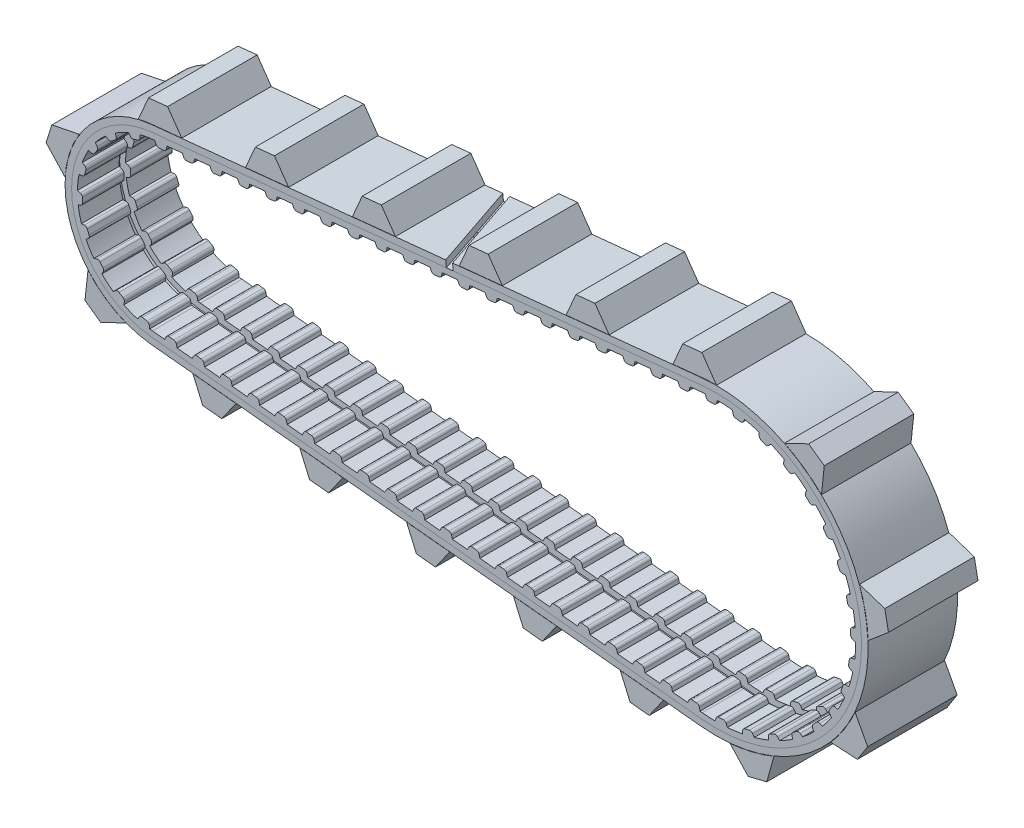
from build123d import *
from build123d.topology import SkipClean

# Parameters (mm, degrees)
EXTRUDE_3_DEPTH       = 20.55
EXTRUDE_1_DEPTH       = 20.55
PATTERN_START         = -20.55
PATTERN_CURVE_2_DEPTH = 41.1
CUT_EXTRUDE_2_DEPTH   = 1.5
EXTRUDE_4_DEPTH       = 20.55
EXTRUDE_2_DEPTH       = 20.55
PATTERN_CURVE_3_DEPTH = 41.1
CUT_EXTRUDE_3_DEPTH   = 321.456949745
CUT_EXTRUDE_START     = -3
CUT_EXTRUDE_1_DEPTH   = 3


# Read off the part's stored shape, not the designer's step: ｶｰﾌﾞ ﾊﾟﾀｰﾝ2, ｶｰﾌﾞ ﾊﾟﾀｰﾝ3, ｶｯﾄ - 押し出し1
with BuildPart() as part:
    # ｽｹｯﾁ1 → 押し出し-薄板3 (new, symmetric)
    with BuildSketch(Plane.XY):
        with BuildLine():
            Line((-259.132698255, 40.767459225), (-6.726519747, 66.354498334))
            ThreePointArc((-6.726519747, 66.354498334), (66.694568873, 0), (-6.726519747, -66.354498334))
            Line((-6.726519747, -66.354498334), (-259.132698255, -40.767459225))
            ThreePointArc((-259.132698255, -40.767459225), (-295.976394748, 0), (-259.132698255, 40.767459225))
        make_face()
        with BuildLine():
            Line((-258.860388176, 38.08122632), (-6.454209668, 63.668265429))
            ThreePointArc((-6.454209668, 63.668265429), (63.994568873, 0), (-6.454209668, -63.668265429))
            Line((-6.454209668, -63.668265429), (-258.860388176, -38.08122632))
            ThreePointArc((-258.860388176, -38.08122632), (-293.276394748, 0), (-258.860388176, 38.08122632))
        make_face(mode=Mode.SUBTRACT)
    extrude(amount=EXTRUDE_3_DEPTH, both=True)

    # ｽｹｯﾁ2 → ﾎﾞｽ - 押し出し1 (add, symmetric)
    with BuildSketch(Plane.XY):
        with BuildLine():
            Line((-18.031105741, 63.184202606), (-11.856400618, 63.810147749))
            Line((-11.856400618, 63.810147749), (-12.398399644, 61.670004094))
            ThreePointArc((-12.398399644, 61.670004094), (-12.831494961, 60.969079346), (-13.588299795, 60.643328675))
            Line((-13.588299795, 60.643328675), (-15.698914123, 60.429370476))
            ThreePointArc((-15.698914123, 60.429370476), (-16.505695259, 60.596616567), (-17.070643258, 61.196367193))
            Line((-17.070643258, 61.196367193), (-18.031105741, 63.184202606))
        make_face()
    extrude(amount=EXTRUDE_1_DEPTH, both=True)

    # ｶｰﾌﾞ ﾊﾟﾀｰﾝ2 outline → ｶｰﾌﾞ ﾊﾟﾀｰﾝ2 (add)
    with BuildSketch(Plane.XY.offset(PATTERN_START)):
        with BuildLine():
            Line((0.122769317, 62.649899214), (0.557965581, 63.992136389))
            ThreePointArc((0.557965581, 63.992136389), (-2.27316707, 63.954183262), (-5.09984989, 63.791036802))
            Line((-5.09984989, 63.791036802), (-4.570456144, 62.483084707))
            ThreePointArc((-4.570456144, 62.483084707), (-4.045974307, 61.847643239), (-3.251869686, 61.627950485))
            Line((-3.251869686, 61.627950485), (-1.131777131, 61.703306378))
            ThreePointArc((-1.131777131, 61.703306378), (-0.35527412, 61.978824308), (0.122769317, 62.649899214))
        make_face()
        with BuildLine():
            Line((12.342799351, 61.422147863), (13.031490923, 62.653691747))
            ThreePointArc((13.031490923, 62.653691747), (10.247353404, 63.168794459), (7.443156207, 63.560241274))
            Line((7.443156207, 63.560241274), (7.707209005, 62.174141516))
            ThreePointArc((7.707209005, 62.174141516), (8.09764459, 61.448588547), (8.833630784, 61.078195002))
            Line((8.833630784, 61.078195002), (10.92768756, 60.738493413))
            ThreePointArc((10.92768756, 60.738493413), (11.743021166, 60.857229121), (12.342799351, 61.422147863))
        make_face()
        with BuildLine():
            Line((24.088502528, 57.833977814), (25.004223378, 58.907500868))
            ThreePointArc((25.004223378, 58.907500868), (22.374073835, 59.955864311), (19.700125986, 60.886861319))
            Line((19.700125986, 60.886861319), (19.688690434, 59.475880934))
            ThreePointArc((19.688690434, 59.475880934), (19.930075547, 58.688099058), (20.579659776, 58.181238737))
            Line((20.579659776, 58.181238737), (22.567207347, 57.439534208))
            ThreePointArc((22.567207347, 57.439534208), (23.390038733, 57.396924747), (24.088502528, 57.833977814))
        make_face()
        with BuildLine():
            Line((34.908498061, 52.023280433), (36.01605755, 52.897527766))
            ThreePointArc((36.01605755, 52.897527766), (33.640971154, 54.438863921), (31.20003097, 55.87363343))
            Line((31.20003097, 55.87363343), (30.913546532, 54.491995602))
            ThreePointArc((30.913546532, 54.491995602), (30.996604878, 53.672258835), (31.534823985, 53.048410096))
            Line((31.534823985, 53.048410096), (33.339482011, 51.933205916))
            ThreePointArc((33.339482011, 51.933205916), (34.138190229, 51.730888744), (34.908498061, 52.023280433))
        make_face()
        with BuildLine():
            Line((44.386979592, 44.213357559), (45.643814829, 44.854732337))
            ThreePointArc((45.643814829, 44.854732337), (43.61506482, 46.82980852), (41.500936262, 48.713213142))
            Line((41.500936262, 48.713213142), (40.950412373, 47.414013439))
            ThreePointArc((40.950412373, 47.414013439), (40.871952066, 46.593823804), (41.278122593, 45.876960805))
            Line((41.278122593, 45.876960805), (42.830539078, 44.431113646))
            ThreePointArc((42.830539078, 44.431113646), (43.57443022, 44.076863698), (44.386979592, 44.213357559))
        make_face()
        with BuildLine():
            Line((52.159694389, 34.704340149), (53.517505901, 35.0881947))
            ThreePointArc((53.517505901, 35.0881947), (51.913056003, 37.42110984), (50.206983847, 39.680771391))
            Line((50.206983847, 39.680771391), (49.413576832, 38.513937329))
            ThreePointArc((49.413576832, 38.513937329), (49.176613058, 37.724814255), (49.435126098, 36.942485638))
            Line((49.435126098, 36.942485638), (50.675642548, 35.221558595))
            ThreePointArc((50.675642548, 35.221558595), (51.336129294, 34.728989498), (52.159694389, 34.704340149))
        make_face()
        with BuildLine():
            Line((57.927941382, 23.86165441), (59.334549235, 23.973237418))
            ThreePointArc((59.334549235, 23.973237418), (58.216057557, 26.574338895), (56.983605199, 29.123419849))
            Line((56.983605199, 29.123419849), (55.977805244, 28.133792206))
            ThreePointArc((55.977805244, 28.133792206), (55.591444388, 27.40606125), (55.692365431, 26.588331466))
            Line((55.692365431, 26.588331466), (56.573309494, 24.658458799))
            ThreePointArc((56.573309494, 24.658458799), (57.125009709, 24.046499708), (57.927941382, 23.86165441))
        make_face()
        with BuildLine():
            Line((61.470050074, 12.101978673), (62.871399117, 11.937002066))
            ThreePointArc((62.871399117, 11.937002066), (62.281848668, 14.706331009), (61.570378561, 17.446871615))
            Line((61.570378561, 17.446871615), (60.390837994, 16.672481227))
            ThreePointArc((60.390837994, 16.672481227), (59.869927686, 16.034108681), (59.809378393, 15.212402627))
            Line((59.809378393, 15.212402627), (60.296895883, 13.147748261))
            ThreePointArc((60.296895883, 13.147748261), (60.718608036, 12.439916419), (61.470050074, 12.101978673))
        make_face()
        with BuildLine():
            Line((62.649899214, -0.122769317), (63.992136389, -0.557965581))
            ThreePointArc((63.992136389, -0.557965581), (63.954183262, 2.27316707), (63.791036803, 5.09984989))
            Line((63.791036803, 5.09984989), (62.483084707, 4.570456144))
            ThreePointArc((62.483084707, 4.570456144), (61.847643239, 4.045974307), (61.627950485, 3.251869686))
            Line((61.627950485, 3.251869686), (61.703306378, 1.131777131))
            ThreePointArc((61.703306378, 1.131777131), (61.978824308, 0.35527412), (62.649899214, -0.122769317))
        make_face()
        with BuildLine():
            Line((61.422147863, -12.342799351), (62.653691747, -13.031490923))
            ThreePointArc((62.653691747, -13.031490923), (63.168794459, -10.247353404), (63.560241275, -7.443156207))
            Line((63.560241275, -7.443156207), (62.174141516, -7.707209005))
            ThreePointArc((62.174141516, -7.707209005), (61.448588547, -8.09764459), (61.078195002, -8.833630784))
            Line((61.078195002, -8.833630784), (60.738493413, -10.92768756))
            ThreePointArc((60.738493413, -10.92768756), (60.857229121, -11.743021166), (61.422147863, -12.342799351))
        make_face()
        with BuildLine():
            Line((57.833977814, -24.088502528), (58.907500868, -25.004223378))
            ThreePointArc((58.907500868, -25.004223378), (59.955864311, -22.374073835), (60.88686132, -19.700125986))
            Line((60.88686132, -19.700125986), (59.475880934, -19.688690434))
            ThreePointArc((59.475880934, -19.688690434), (58.688099058, -19.930075547), (58.181238737, -20.579659776))
            Line((58.181238737, -20.579659776), (57.439534208, -22.567207347))
            ThreePointArc((57.439534208, -22.567207347), (57.396924747, -23.390038733), (57.833977814, -24.088502528))
        make_face()
        with BuildLine():
            Line((52.023280433, -34.908498061), (52.897527766, -36.01605755))
            ThreePointArc((52.897527766, -36.01605755), (54.438863921, -33.640971155), (55.87363343, -31.20003097))
            Line((55.87363343, -31.20003097), (54.491995602, -30.913546532))
            ThreePointArc((54.491995602, -30.913546532), (53.672258835, -30.996604878), (53.048410096, -31.534823985))
            Line((53.048410096, -31.534823985), (51.933205916, -33.339482011))
            ThreePointArc((51.933205916, -33.339482011), (51.730888744, -34.138190229), (52.023280433, -34.908498061))
        make_face()
        with BuildLine():
            Line((44.213357559, -44.386979592), (44.854732337, -45.643814829))
            ThreePointArc((44.854732337, -45.643814829), (46.82980852, -43.61506482), (48.713213142, -41.500936262))
            Line((48.713213142, -41.500936262), (47.414013439, -40.950412373))
            ThreePointArc((47.414013439, -40.950412373), (46.593823804, -40.871952066), (45.876960805, -41.278122593))
            Line((45.876960805, -41.278122593), (44.431113646, -42.830539078))
            ThreePointArc((44.431113646, -42.830539078), (44.076863698, -43.57443022), (44.213357559, -44.386979592))
        make_face()
        with BuildLine():
            Line((34.704340149, -52.159694389), (35.0881947, -53.517505901))
            ThreePointArc((35.0881947, -53.517505901), (37.42110984, -51.913056003), (39.680771391, -50.206983847))
            Line((39.680771391, -50.206983847), (38.513937329, -49.413576832))
            ThreePointArc((38.513937329, -49.413576832), (37.724814255, -49.176613058), (36.942485638, -49.435126098))
            Line((36.942485638, -49.435126098), (35.221558595, -50.675642548))
            ThreePointArc((35.221558595, -50.675642548), (34.728989498, -51.336129294), (34.704340149, -52.159694389))
        make_face()
        with BuildLine():
            Line((23.86165441, -57.927941382), (23.973237418, -59.334549235))
            ThreePointArc((23.973237418, -59.334549235), (26.574338895, -58.216057557), (29.123419849, -56.983605199))
            Line((29.123419849, -56.983605199), (28.133792206, -55.977805244))
            ThreePointArc((28.133792206, -55.977805244), (27.40606125, -55.591444388), (26.588331466, -55.692365431))
            Line((26.588331466, -55.692365431), (24.658458799, -56.573309494))
            ThreePointArc((24.658458799, -56.573309494), (24.046499708, -57.125009709), (23.86165441, -57.927941382))
        make_face()
        with BuildLine():
            Line((12.101978673, -61.470050074), (11.937002066, -62.871399117))
            ThreePointArc((11.937002066, -62.871399117), (14.706331009, -62.281848668), (17.446871615, -61.57037856))
            Line((17.446871615, -61.57037856), (16.672481227, -60.390837994))
            ThreePointArc((16.672481227, -60.390837994), (16.034108681, -59.869927686), (15.212402627, -59.809378393))
            Line((15.212402627, -59.809378393), (13.147748261, -60.296895883))
            ThreePointArc((13.147748261, -60.296895883), (12.439916419, -60.718608036), (12.101978673, -61.470050074))
        make_face()
        with BuildLine():
            Line((-0.122769317, -62.649899214), (-0.557965581, -63.992136389))
            ThreePointArc((-0.557965581, -63.992136389), (2.27316707, -63.954183262), (5.09984989, -63.791036802))
            Line((5.09984989, -63.791036802), (4.570456144, -62.483084707))
            ThreePointArc((4.570456144, -62.483084707), (4.045974307, -61.847643239), (3.251869686, -61.627950485))
            Line((3.251869686, -61.627950485), (1.131777131, -61.703306378))
            ThreePointArc((1.131777131, -61.703306378), (0.35527412, -61.978824308), (-0.122769317, -62.649899214))
        make_face()
        with BuildLine():
            Line((-12.498041941, -61.659903107), (-13.140907029, -62.990418366))
            Line((-13.140907029, -62.990418366), (-7.463022832, -63.565999541))
            Line((-7.463022832, -63.565999541), (-7.825798326, -62.133540008))
            ThreePointArc((-7.825798326, -62.133540008), (-8.258893644, -61.43261526), (-9.015698478, -61.106864589))
            Line((-9.015698478, -61.106864589), (-11.126312806, -60.89290639))
            ThreePointArc((-11.126312806, -60.89290639), (-11.933093941, -61.060152481), (-12.498041941, -61.659903107))
        make_face()
        with BuildLine():
            Line((-25.133285606, -60.37903718), (-25.776150694, -61.709552439))
            Line((-25.776150694, -61.709552439), (-20.098266497, -62.285133614))
            Line((-20.098266497, -62.285133614), (-20.461041992, -60.852674081))
            ThreePointArc((-20.461041992, -60.852674081), (-20.894137309, -60.151749333), (-21.650942143, -59.825998662))
            Line((-21.650942143, -59.825998662), (-23.761556471, -59.612040463))
            ThreePointArc((-23.761556471, -59.612040463), (-24.568337607, -59.779286554), (-25.133285606, -60.37903718))
        make_face()
        with BuildLine():
            Line((-37.768529271, -59.098171253), (-38.411394359, -60.428686512))
            Line((-38.411394359, -60.428686512), (-32.733510163, -61.004267687))
            Line((-32.733510163, -61.004267687), (-33.096285657, -59.571808154))
            ThreePointArc((-33.096285657, -59.571808154), (-33.529380974, -58.870883406), (-34.286185808, -58.545132735))
            Line((-34.286185808, -58.545132735), (-36.396800136, -58.331174536))
            ThreePointArc((-36.396800136, -58.331174536), (-37.203581272, -58.498420627), (-37.768529271, -59.098171253))
        make_face()
        with BuildLine():
            Line((-50.403772937, -57.817305326), (-51.046638025, -59.147820585))
            Line((-51.046638025, -59.147820585), (-45.368753828, -59.72340176))
            Line((-45.368753828, -59.72340176), (-45.731529322, -58.290942227))
            ThreePointArc((-45.731529322, -58.290942227), (-46.164624639, -57.590017479), (-46.921429473, -57.264266808))
            Line((-46.921429473, -57.264266808), (-49.032043801, -57.050308609))
            ThreePointArc((-49.032043801, -57.050308609), (-49.838824937, -57.2175547), (-50.403772937, -57.817305326))
        make_face()
        with BuildLine():
            Line((-63.039016602, -56.536439399), (-63.68188169, -57.866954658))
            Line((-63.68188169, -57.866954658), (-58.003997493, -58.442535833))
            Line((-58.003997493, -58.442535833), (-58.366772987, -57.0100763))
            ThreePointArc((-58.366772987, -57.0100763), (-58.799868304, -56.309151552), (-59.556673138, -55.983400881))
            Line((-59.556673138, -55.983400881), (-61.667287466, -55.769442682))
            ThreePointArc((-61.667287466, -55.769442682), (-62.474068602, -55.936688773), (-63.039016602, -56.536439399))
        make_face()
        with BuildLine():
            Line((-75.674260267, -55.255573472), (-76.317125355, -56.586088731))
            Line((-76.317125355, -56.586088731), (-70.639241158, -57.161669906))
            Line((-70.639241158, -57.161669906), (-71.002016652, -55.729210373))
            ThreePointArc((-71.002016652, -55.729210373), (-71.435111969, -55.028285625), (-72.191916803, -54.702534954))
            Line((-72.191916803, -54.702534954), (-74.302531131, -54.488576755))
            ThreePointArc((-74.302531131, -54.488576755), (-75.109312267, -54.655822846), (-75.674260267, -55.255573472))
        make_face()
        with BuildLine():
            Line((-88.309503932, -53.974707545), (-88.95236902, -55.305222804))
            Line((-88.95236902, -55.305222804), (-83.274484823, -55.880803979))
            Line((-83.274484823, -55.880803979), (-83.637260317, -54.448344446))
            ThreePointArc((-83.637260317, -54.448344446), (-84.070355635, -53.747419698), (-84.827160468, -53.421669027))
            Line((-84.827160468, -53.421669027), (-86.937774796, -53.207710828))
            ThreePointArc((-86.937774796, -53.207710828), (-87.744555932, -53.374956919), (-88.309503932, -53.974707545))
        make_face()
        with BuildLine():
            Line((-100.944747597, -52.693841618), (-101.587612685, -54.024356877))
            Line((-101.587612685, -54.024356877), (-95.909728488, -54.599938052))
            Line((-95.909728488, -54.599938052), (-96.272503982, -53.167478519))
            ThreePointArc((-96.272503982, -53.167478519), (-96.7055993, -52.466553771), (-97.462404133, -52.1408031))
            Line((-97.462404133, -52.1408031), (-99.573018462, -51.926844901))
            ThreePointArc((-99.573018462, -51.926844901), (-100.379799597, -52.094090992), (-100.944747597, -52.693841618))
        make_face()
        with BuildLine():
            Line((-113.579991262, -51.412975691), (-114.22285635, -52.74349095))
            Line((-114.22285635, -52.74349095), (-108.544972153, -53.319072126))
            Line((-108.544972153, -53.319072126), (-108.907747647, -51.886612592))
            ThreePointArc((-108.907747647, -51.886612592), (-109.340842965, -51.185687844), (-110.097647799, -50.859937173))
            Line((-110.097647799, -50.859937173), (-112.208262127, -50.645978974))
            ThreePointArc((-112.208262127, -50.645978974), (-113.015043262, -50.813225065), (-113.579991262, -51.412975691))
        make_face()
        with BuildLine():
            Line((-126.215234927, -50.132109764), (-126.858100015, -51.462625023))
            Line((-126.858100015, -51.462625023), (-121.180215818, -52.038206199))
            Line((-121.180215818, -52.038206199), (-121.542991313, -50.605746665))
            ThreePointArc((-121.542991313, -50.605746665), (-121.97608663, -49.904821917), (-122.732891464, -49.579071246))
            Line((-122.732891464, -49.579071246), (-124.843505792, -49.365113047))
            ThreePointArc((-124.843505792, -49.365113047), (-125.650286928, -49.532359138), (-126.215234927, -50.132109764))
        make_face()
        with BuildLine():
            Line((-138.850478592, -48.851243837), (-139.49334368, -50.181759096))
            Line((-139.49334368, -50.181759096), (-133.815459484, -50.757340271))
            Line((-133.815459484, -50.757340271), (-134.178234978, -49.324880738))
            ThreePointArc((-134.178234978, -49.324880738), (-134.611330295, -48.62395599), (-135.368135129, -48.298205319))
            Line((-135.368135129, -48.298205319), (-137.478749457, -48.08424712))
            ThreePointArc((-137.478749457, -48.08424712), (-138.285530593, -48.251493211), (-138.850478592, -48.851243837))
        make_face()
        with BuildLine():
            Line((-151.485722258, -47.57037791), (-152.128587346, -48.900893169))
            Line((-152.128587346, -48.900893169), (-146.450703149, -49.476474345))
            Line((-146.450703149, -49.476474345), (-146.813478643, -48.044014811))
            ThreePointArc((-146.813478643, -48.044014811), (-147.24657396, -47.343090063), (-148.003378794, -47.017339392))
            Line((-148.003378794, -47.017339392), (-150.113993122, -46.803381193))
            ThreePointArc((-150.113993122, -46.803381193), (-150.920774258, -46.970627284), (-151.485722258, -47.57037791))
        make_face()
        with BuildLine():
            Line((-164.120965923, -46.289511983), (-164.763831011, -47.620027242))
            Line((-164.763831011, -47.620027242), (-159.085946814, -48.195608418))
            Line((-159.085946814, -48.195608418), (-159.448722308, -46.763148884))
            ThreePointArc((-159.448722308, -46.763148884), (-159.881817625, -46.062224136), (-160.638622459, -45.736473465))
            Line((-160.638622459, -45.736473465), (-162.749236787, -45.522515266))
            ThreePointArc((-162.749236787, -45.522515266), (-163.556017923, -45.689761357), (-164.120965923, -46.289511983))
        make_face()
        with BuildLine():
            Line((-176.756209588, -45.008646056), (-177.399074676, -46.339161314))
            Line((-177.399074676, -46.339161314), (-171.721190479, -46.914742491))
            Line((-171.721190479, -46.914742491), (-172.083965973, -45.482282957))
            ThreePointArc((-172.083965973, -45.482282957), (-172.51706129, -44.781358209), (-173.273866124, -44.455607538))
            Line((-173.273866124, -44.455607538), (-175.384480452, -44.241649339))
            ThreePointArc((-175.384480452, -44.241649339), (-176.191261588, -44.40889543), (-176.756209588, -45.008646056))
        make_face()
        with BuildLine():
            Line((-189.391453253, -43.727780129), (-190.034318341, -45.058295387))
            Line((-190.034318341, -45.058295387), (-184.356434144, -45.633876564))
            Line((-184.356434144, -45.633876564), (-184.719209638, -44.20141703))
            ThreePointArc((-184.719209638, -44.20141703), (-185.152304956, -43.500492282), (-185.909109789, -43.174741611))
            Line((-185.909109789, -43.174741611), (-188.019724117, -42.960783412))
            ThreePointArc((-188.019724117, -42.960783412), (-188.826505253, -43.128029503), (-189.391453253, -43.727780129))
        make_face()
        with BuildLine():
            Line((-202.026696918, -42.446914202), (-202.669562006, -43.77742946))
            Line((-202.669562006, -43.77742946), (-196.991677809, -44.353010637))
            Line((-196.991677809, -44.353010637), (-197.354453303, -42.920551103))
            ThreePointArc((-197.354453303, -42.920551103), (-197.787548621, -42.219626355), (-198.544353454, -41.893875684))
            Line((-198.544353454, -41.893875684), (-200.654967782, -41.679917485))
            ThreePointArc((-200.654967782, -41.679917485), (-201.461748918, -41.847163576), (-202.026696918, -42.446914202))
        make_face()
        with BuildLine():
            Line((-214.661940583, -41.166048275), (-215.304805671, -42.496563533))
            Line((-215.304805671, -42.496563533), (-209.626921474, -43.07214471))
            Line((-209.626921474, -43.07214471), (-209.989696968, -41.639685176))
            ThreePointArc((-209.989696968, -41.639685176), (-210.422792286, -40.938760428), (-211.17959712, -40.613009757))
            Line((-211.17959712, -40.613009757), (-213.290211448, -40.399051558))
            ThreePointArc((-213.290211448, -40.399051558), (-214.096992583, -40.566297649), (-214.661940583, -41.166048275))
        make_face()
        with BuildLine():
            Line((-227.297184248, -39.885182348), (-227.940049336, -41.215697606))
            Line((-227.940049336, -41.215697606), (-222.262165139, -41.791278783))
            Line((-222.262165139, -41.791278783), (-222.624940634, -40.358819249))
            ThreePointArc((-222.624940634, -40.358819249), (-223.058035951, -39.657894501), (-223.814840785, -39.33214383))
            Line((-223.814840785, -39.33214383), (-225.925455113, -39.118185631))
            ThreePointArc((-225.925455113, -39.118185631), (-226.732236249, -39.285431722), (-227.297184248, -39.885182348))
        make_face()
        with BuildLine():
            Line((-239.932427913, -38.604316421), (-240.575293001, -39.934831679))
            Line((-240.575293001, -39.934831679), (-234.897408805, -40.510412856))
            Line((-234.897408805, -40.510412856), (-235.260184299, -39.077953322))
            ThreePointArc((-235.260184299, -39.077953322), (-235.693279616, -38.377028574), (-236.45008445, -38.051277903))
            Line((-236.45008445, -38.051277903), (-238.560698778, -37.837319704))
            ThreePointArc((-238.560698778, -37.837319704), (-239.367479914, -38.004565795), (-239.932427913, -38.604316421))
        make_face()
        with BuildLine():
            Line((-252.567671579, -37.323450494), (-253.210536667, -38.653965752))
            Line((-253.210536667, -38.653965752), (-247.53265247, -39.229546929))
            Line((-247.53265247, -39.229546929), (-247.895427964, -37.797087395))
            ThreePointArc((-247.895427964, -37.797087395), (-248.328523281, -37.096162647), (-249.085328115, -36.770411976))
            Line((-249.085328115, -36.770411976), (-251.195942443, -36.556453777))
            ThreePointArc((-251.195942443, -36.556453777), (-252.002723579, -36.723699868), (-252.567671579, -37.323450494))
        make_face()
        with BuildLine():
            Line((-264.914754414, -35.607906214), (-265.637646638, -36.768503762))
            ThreePointArc((-265.637646638, -36.768503762), (-262.90400501, -37.4514232), (-260.12753215, -37.931396085))
            Line((-260.12753215, -37.931396085), (-260.319782303, -36.577660618))
            ThreePointArc((-260.319782303, -36.577660618), (-260.675569138, -35.83450331), (-261.393270171, -35.429815427))
            Line((-261.393270171, -35.429815427), (-263.468978284, -34.991743762))
            ThreePointArc((-263.468978284, -34.991743762), (-264.289003987, -35.071899256), (-264.914754414, -35.607906214))
        make_face()
        with BuildLine():
            Line((-275.794843927, -30.558138131), (-276.851311971, -31.42614453))
            ThreePointArc((-276.851311971, -31.42614453), (-274.480289891, -32.948455209), (-272.003705528, -34.292220593))
            Line((-272.003705528, -34.292220593), (-271.752347812, -32.948204546))
            ThreePointArc((-271.752347812, -32.948204546), (-271.851431441, -32.130250091), (-272.401755399, -31.517053062))
            Line((-272.401755399, -31.517053062), (-274.227890962, -30.437377249))
            ThreePointArc((-274.227890962, -30.437377249), (-275.030405324, -30.250728504), (-275.794843927, -30.558138131))
        make_face()
        with BuildLine():
            Line((-284.485038853, -22.290307845), (-285.763826598, -22.774313775))
            ThreePointArc((-285.763826598, -22.774313775), (-284.005115212, -24.975701921), (-282.089227204, -27.041748545))
            Line((-282.089227204, -27.041748545), (-281.420731973, -25.848989575))
            ThreePointArc((-281.420731973, -25.848989575), (-281.252677948, -25.042376346), (-281.577670492, -24.285245642))
            Line((-281.577670492, -24.285245642), (-282.961924084, -22.677665801))
            ThreePointArc((-282.961924084, -22.677665801), (-283.662414721, -22.243868702), (-284.485038853, -22.290307845))
        make_face()
        with BuildLine():
            Line((-290.070179122, -11.675096416), (-291.436618072, -11.724131456))
            ThreePointArc((-291.436618072, -11.724131456), (-290.475426393, -14.372769988), (-289.321995946, -16.943523518))
            Line((-289.321995946, -16.943523518), (-288.306762098, -16.027630472))
            ThreePointArc((-288.306762098, -16.027630472), (-287.889268105, -15.317302504), (-287.954704432, -14.495971181))
            Line((-287.954704432, -14.495971181), (-288.751301002, -12.529780738))
            ThreePointArc((-288.751301002, -12.529780738), (-289.275999596, -11.89451824), (-290.070179122, -11.675096416))
        make_face()
        with BuildLine():
            Line((-291.962096413, 0.169613562), (-293.272287566, 0.560713267))
            ThreePointArc((-293.272287566, 0.560713267), (-293.20983821, -2.256248854), (-292.940332504, -5.060984525))
            Line((-292.940332504, -5.060984525), (-291.685273807, -4.518409642))
            ThreePointArc((-291.685273807, -4.518409642), (-291.062305929, -3.979171217), (-290.861294972, -3.180133263))
            Line((-290.861294972, -3.180133263), (-290.986345335, -1.062390748))
            ThreePointArc((-290.986345335, -1.062390748), (-291.279996141, -0.292562027), (-291.962096413, 0.169613562))
        make_face()
        with BuildLine():
            Line((-289.961553864, 11.996461621), (-291.077521647, 12.786509558))
            ThreePointArc((-291.077521647, 12.786509558), (-291.920391124, 10.097876716), (-292.563191671, 7.354524211))
            Line((-292.563191671, 7.354524211), (-291.200477727, 7.466642643))
            ThreePointArc((-291.200477727, 7.466642643), (-290.437640398, 7.778004597), (-289.991350521, 8.470602894))
            Line((-289.991350521, 8.470602894), (-289.431685685, 10.516879079))
            ThreePointArc((-289.431685685, 10.516879079), (-289.463364483, 11.340203747), (-289.961553864, 11.996461621))
        make_face()
        with BuildLine():
            Line((-284.279227608, 22.559968322), (-285.083450015, 23.665764938))
            ThreePointArc((-285.083450015, 23.665764938), (-286.742876161, 21.388599952), (-288.230289958, 18.99553169))
            Line((-288.230289958, 18.99553169), (-286.903427489, 18.665386535))
            ThreePointArc((-286.903427489, 18.665386535), (-286.081054727, 18.716082646), (-285.436484492, 19.229304107))
            Line((-285.436484492, 19.229304107), (-284.25104248, 20.988621643))
            ThreePointArc((-284.25104248, 20.988621643), (-284.017413192, 21.778738351), (-284.279227608, 22.559968322))
        make_face()
        with BuildLine():
            Line((-275.513520574, 30.747696071), (-275.921305345, 32.05279048))
            ThreePointArc((-275.921305345, 32.05279048), (-278.222534827, 30.426900452), (-280.397923072, 28.636129252))
            Line((-280.397923072, 28.636129252), (-279.246643299, 27.898487929))
            ThreePointArc((-279.246643299, 27.898487929), (-278.451338766, 27.683179416), (-277.676367542, 27.962976947))
            Line((-277.676367542, 27.962976947), (-275.989986659, 29.250062986))
            ThreePointArc((-275.989986659, 29.250062986), (-275.515652668, 29.923764939), (-275.513520574, 30.747696071))
        make_face()
        with BuildLine():
            Line((-264.587544975, 35.697399364), (-264.5559485, 37.064352728))
            ThreePointArc((-264.5559485, 37.064352728), (-267.256639994, 36.260959322), (-269.890913642, 35.261070401))
            Line((-269.890913642, 35.261070401), (-269.036457261, 34.193613549))
            ThreePointArc((-269.036457261, 34.193613549), (-268.351974079, 33.734974443), (-267.528213697, 33.751882706))
            Line((-267.528213697, 33.751882706), (-265.518485868, 34.431194863))
            ThreePointArc((-265.518485868, 34.431194863), (-264.853399049, 34.917534846), (-264.587544975, 35.697399364))
        make_face()
        with BuildLine():
            Line((-24.670867815, 61.8215977), (-30.348752012, 61.246016524))
            Line((-30.348752012, 61.246016524), (-29.705886924, 59.915501266))
            ThreePointArc((-29.705886924, 59.915501266), (-29.140938924, 59.31575064), (-28.334157788, 59.148504549))
            Line((-28.334157788, 59.148504549), (-26.22354346, 59.362462748))
            ThreePointArc((-26.22354346, 59.362462748), (-25.466738626, 59.688213419), (-25.033643309, 60.389138167))
            Line((-25.033643309, 60.389138167), (-24.670867815, 61.8215977))
        make_face()
        with BuildLine():
            Line((-37.30611148, 60.540731773), (-42.983995677, 59.965150597))
            Line((-42.983995677, 59.965150597), (-42.341130589, 58.634635339))
            ThreePointArc((-42.341130589, 58.634635339), (-41.776182589, 58.034884713), (-40.969401453, 57.867638622))
            Line((-40.969401453, 57.867638622), (-38.858787125, 58.081596821))
            ThreePointArc((-38.858787125, 58.081596821), (-38.101982291, 58.407347492), (-37.668886974, 59.10827224))
            Line((-37.668886974, 59.10827224), (-37.30611148, 60.540731773))
        make_face()
        with BuildLine():
            Line((-49.941355145, 59.259865846), (-55.619239342, 58.68428467))
            Line((-55.619239342, 58.68428467), (-54.976374254, 57.353769412))
            ThreePointArc((-54.976374254, 57.353769412), (-54.411426254, 56.754018786), (-53.604645118, 56.586772695))
            Line((-53.604645118, 56.586772695), (-51.49403079, 56.800730894))
            ThreePointArc((-51.49403079, 56.800730894), (-50.737225956, 57.126481565), (-50.304130639, 57.827406313))
            Line((-50.304130639, 57.827406313), (-49.941355145, 59.259865846))
        make_face()
        with BuildLine():
            Line((-62.57659881, 57.978999919), (-68.254483007, 57.403418743))
            Line((-68.254483007, 57.403418743), (-67.611617919, 56.072903485))
            ThreePointArc((-67.611617919, 56.072903485), (-67.046669919, 55.473152859), (-66.239888783, 55.305906768))
            Line((-66.239888783, 55.305906768), (-64.129274455, 55.519864967))
            ThreePointArc((-64.129274455, 55.519864967), (-63.372469622, 55.845615638), (-62.939374304, 56.546540386))
            Line((-62.939374304, 56.546540386), (-62.57659881, 57.978999919))
        make_face()
        with BuildLine():
            Line((-75.211842475, 56.698133992), (-80.889726672, 56.122552816))
            Line((-80.889726672, 56.122552816), (-80.246861584, 54.792037558))
            ThreePointArc((-80.246861584, 54.792037558), (-79.681913584, 54.192286932), (-78.875132448, 54.025040841))
            Line((-78.875132448, 54.025040841), (-76.76451812, 54.23899904))
            ThreePointArc((-76.76451812, 54.23899904), (-76.007713287, 54.564749711), (-75.574617969, 55.265674459))
            Line((-75.574617969, 55.265674459), (-75.211842475, 56.698133992))
        make_face()
        with BuildLine():
            Line((-87.84708614, 55.417268065), (-93.524970337, 54.841686889))
            Line((-93.524970337, 54.841686889), (-92.882105249, 53.511171631))
            ThreePointArc((-92.882105249, 53.511171631), (-92.317157249, 52.911421005), (-91.510376114, 52.744174914))
            Line((-91.510376114, 52.744174914), (-89.399761785, 52.958133113))
            ThreePointArc((-89.399761785, 52.958133113), (-88.642956952, 53.283883784), (-88.209861634, 53.984808532))
            Line((-88.209861634, 53.984808532), (-87.84708614, 55.417268065))
        make_face()
        with BuildLine():
            Line((-100.482329805, 54.136402138), (-106.160214002, 53.560820962))
            Line((-106.160214002, 53.560820962), (-105.517348914, 52.230305704))
            ThreePointArc((-105.517348914, 52.230305704), (-104.952400914, 51.630555078), (-104.145619779, 51.463308987))
            Line((-104.145619779, 51.463308987), (-102.035005451, 51.677267186))
            ThreePointArc((-102.035005451, 51.677267186), (-101.278200617, 52.003017857), (-100.845105299, 52.703942605))
            Line((-100.845105299, 52.703942605), (-100.482329805, 54.136402138))
        make_face()
        with BuildLine():
            Line((-113.11757347, 52.855536211), (-118.795457667, 52.279955035))
            Line((-118.795457667, 52.279955035), (-118.152592579, 50.949439777))
            ThreePointArc((-118.152592579, 50.949439777), (-117.58764458, 50.349689151), (-116.780863444, 50.18244306))
            Line((-116.780863444, 50.18244306), (-114.670249116, 50.396401259))
            ThreePointArc((-114.670249116, 50.396401259), (-113.913444282, 50.72215193), (-113.480348965, 51.423076678))
            Line((-113.480348965, 51.423076678), (-113.11757347, 52.855536211))
        make_face()
        with BuildLine():
            Line((-125.752817136, 51.574670284), (-131.430701333, 50.999089108))
            Line((-131.430701333, 50.999089108), (-130.787836244, 49.66857385))
            ThreePointArc((-130.787836244, 49.66857385), (-130.222888245, 49.068823224), (-129.416107109, 48.901577133))
            Line((-129.416107109, 48.901577133), (-127.305492781, 49.115535332))
            ThreePointArc((-127.305492781, 49.115535332), (-126.548687947, 49.441286003), (-126.11559263, 50.142210751))
            Line((-126.11559263, 50.142210751), (-125.752817136, 51.574670284))
        make_face()
        with BuildLine():
            Line((-138.388060801, 50.293804357), (-144.065944998, 49.718223181))
            Line((-144.065944998, 49.718223181), (-143.42307991, 48.387707923))
            ThreePointArc((-143.42307991, 48.387707923), (-142.85813191, 47.787957297), (-142.051350774, 47.620711206))
            Line((-142.051350774, 47.620711206), (-139.940736446, 47.834669405))
            ThreePointArc((-139.940736446, 47.834669405), (-139.183931612, 48.160420076), (-138.750836295, 48.861344824))
            Line((-138.750836295, 48.861344824), (-138.388060801, 50.293804357))
        make_face()
        with BuildLine():
            Line((-151.023304466, 49.01293843), (-156.701188663, 48.437357254))
            Line((-156.701188663, 48.437357254), (-156.058323575, 47.106841996))
            ThreePointArc((-156.058323575, 47.106841996), (-155.493375575, 46.50709137), (-154.686594439, 46.339845279))
            Line((-154.686594439, 46.339845279), (-152.575980111, 46.553803478))
            ThreePointArc((-152.575980111, 46.553803478), (-151.819175277, 46.879554149), (-151.38607996, 47.580478897))
            Line((-151.38607996, 47.580478897), (-151.023304466, 49.01293843))
        make_face()
        with BuildLine():
            Line((-163.658548131, 47.732072503), (-169.336432328, 47.156491327))
            Line((-169.336432328, 47.156491327), (-168.69356724, 45.825976069))
            ThreePointArc((-168.69356724, 45.825976069), (-168.12861924, 45.226225443), (-167.321838104, 45.058979352))
            Line((-167.321838104, 45.058979352), (-165.211223776, 45.272937551))
            ThreePointArc((-165.211223776, 45.272937551), (-164.454418943, 45.598688222), (-164.021323625, 46.29961297))
            Line((-164.021323625, 46.29961297), (-163.658548131, 47.732072503))
        make_face()
        with BuildLine():
            Line((-176.293791796, 46.451206576), (-181.971675993, 45.8756254))
            Line((-181.971675993, 45.8756254), (-181.328810905, 44.545110142))
            ThreePointArc((-181.328810905, 44.545110142), (-180.763862905, 43.945359516), (-179.957081769, 43.778113425))
            Line((-179.957081769, 43.778113425), (-177.846467441, 43.992071624))
            ThreePointArc((-177.846467441, 43.992071624), (-177.089662608, 44.317822295), (-176.65656729, 45.018747043))
            Line((-176.65656729, 45.018747043), (-176.293791796, 46.451206576))
        make_face()
        with BuildLine():
            Line((-188.929035461, 45.170340649), (-194.606919658, 44.594759473))
            Line((-194.606919658, 44.594759473), (-193.96405457, 43.264244215))
            ThreePointArc((-193.96405457, 43.264244215), (-193.39910657, 42.664493589), (-192.592325435, 42.497247498))
            Line((-192.592325435, 42.497247498), (-190.481711106, 42.711205697))
            ThreePointArc((-190.481711106, 42.711205697), (-189.724906273, 43.036956368), (-189.291810955, 43.737881116))
            Line((-189.291810955, 43.737881116), (-188.929035461, 45.170340649))
        make_face()
        with BuildLine():
            Line((-201.564279126, 43.889474722), (-207.242163323, 43.313893546))
            Line((-207.242163323, 43.313893546), (-206.599298235, 41.983378288))
            ThreePointArc((-206.599298235, 41.983378288), (-206.034350235, 41.383627662), (-205.2275691, 41.216381571))
            Line((-205.2275691, 41.216381571), (-203.116954772, 41.43033977))
            ThreePointArc((-203.116954772, 41.43033977), (-202.360149938, 41.756090441), (-201.92705462, 42.457015189))
            Line((-201.92705462, 42.457015189), (-201.564279126, 43.889474722))
        make_face()
        with BuildLine():
            Line((-214.199522791, 42.608608795), (-219.877406988, 42.033027619))
            Line((-219.877406988, 42.033027619), (-219.2345419, 40.702512361))
            ThreePointArc((-219.2345419, 40.702512361), (-218.669593901, 40.102761735), (-217.862812765, 39.935515644))
            Line((-217.862812765, 39.935515644), (-215.752198437, 40.149473842))
            ThreePointArc((-215.752198437, 40.149473842), (-214.995393603, 40.475224514), (-214.562298286, 41.176149262))
            Line((-214.562298286, 41.176149262), (-214.199522791, 42.608608795))
        make_face()
        with BuildLine():
            Line((-226.834766457, 41.327742868), (-232.512650653, 40.752161693))
            Line((-232.512650653, 40.752161693), (-231.869785565, 39.421646434))
            ThreePointArc((-231.869785565, 39.421646434), (-231.304837566, 38.821895808), (-230.49805643, 38.654649717))
            Line((-230.49805643, 38.654649717), (-228.387442102, 38.868607915))
            ThreePointArc((-228.387442102, 38.868607915), (-227.630637268, 39.194358587), (-227.197541951, 39.895283335))
            Line((-227.197541951, 39.895283335), (-226.834766457, 41.327742868))
        make_face()
        with BuildLine():
            Line((-239.470010122, 40.046876941), (-245.147894319, 39.471295765))
            Line((-245.147894319, 39.471295765), (-244.505029231, 38.140780507))
            ThreePointArc((-244.505029231, 38.140780507), (-243.940081231, 37.541029881), (-243.133300095, 37.37378379))
            Line((-243.133300095, 37.37378379), (-241.022685767, 37.587741988))
            ThreePointArc((-241.022685767, 37.587741988), (-240.265880933, 37.91349266), (-239.832785616, 38.614417408))
            Line((-239.832785616, 38.614417408), (-239.470010122, 40.046876941))
        make_face()
        with BuildLine():
            Line((-255.76854376, 36.092917863), (-253.657929432, 36.306876061))
            ThreePointArc((-253.657929432, 36.306876061), (-252.901124598, 36.632626733), (-252.468029281, 37.333551481))
            Line((-252.468029281, 37.333551481), (-252.105253787, 38.766011014))
            Line((-252.105253787, 38.766011014), (-257.783137984, 38.190429839))
            Line((-257.783137984, 38.190429839), (-257.140272896, 36.85991458))
            ThreePointArc((-257.140272896, 36.85991458), (-256.575324896, 36.260163954), (-255.76854376, 36.092917863))
        make_face()
    extrude(amount=PATTERN_CURVE_2_DEPTH)

    # ｽｹｯﾁ1<4> → ｶｯﾄ-押し出し-薄板2 (cut, symmetric)
    with BuildSketch(Plane.XY):
        with BuildLine():
            Line((-259.3646661, 43.055731699), (-6.958487592, 68.642770809))
            ThreePointArc((-6.958487592, 68.642770809), (68.994568873, 0), (-6.958487592, -68.642770809))
            Line((-6.958487592, -68.642770809), (-259.3646661, -43.055731699))
            ThreePointArc((-259.3646661, -43.055731699), (-298.276394748, 0), (-259.3646661, 43.055731699))
        make_face()
        with BuildLine():
            Line((-258.356110252, 33.10672094), (-5.949931744, 58.693760049))
            ThreePointArc((-5.949931744, 58.693760049), (58.994568873, 0), (-5.949931744, -58.693760049))
            Line((-5.949931744, -58.693760049), (-258.356110252, -33.10672094))
            ThreePointArc((-258.356110252, -33.10672094), (-288.276394748, 0), (-258.356110252, 33.10672094))
        make_face(mode=Mode.SUBTRACT)
    extrude(amount=CUT_EXTRUDE_2_DEPTH, both=True, mode=Mode.SUBTRACT)


with BuildPart() as cut_extrude_2_piece_1:
    # of the separate pieces the step leaves, piece 1, a body of its own (cut_extrude_2_pieces)
    add(part.part.solids().sort_by_distance((-6.726519747, -66.354498334, -20.55))[0])


with BuildPart() as cut_extrude_2_piece_2:
    # of the separate pieces the step leaves, piece 2, a body of its own (cut_extrude_2_pieces)
    add(part.part.solids().sort_by_distance((-6.726519747, -66.354498334, 1.5))[0])


with BuildPart() as body_3:
    # ｽｹｯﾁ9 → 押し出し-薄板4 (new, symmetric)
    with BuildSketch(Plane.XY):
        with BuildLine():
            Line((-7.029086501, -69.339201562), (-259.43526501, -43.752162453))
            ThreePointArc((-259.43526501, -43.752162453), (-298.976394748, 0), (-259.43526501, 43.752162453))
            Line((-259.43526501, 43.752162453), (-7.029086501, 69.339201562))
            ThreePointArc((-7.029086501, 69.339201562), (69.694568873, 0), (-7.029086501, -69.339201562))
        make_face()
        with BuildLine():
            Line((-6.726519747, -66.354498334), (-259.132698255, -40.767459225))
            ThreePointArc((-259.132698255, -40.767459225), (-295.976394748, 0), (-259.132698255, 40.767459225))
            Line((-259.132698255, 40.767459225), (-6.726519747, 66.354498334))
            ThreePointArc((-6.726519747, 66.354498334), (66.694568873, 0), (-6.726519747, -66.354498334))
        make_face(mode=Mode.SUBTRACT)
    extrude(amount=EXTRUDE_4_DEPTH, both=True)

    # ｽｹｯﾁ6 → ﾎﾞｽ - 押し出し2 (add, symmetric)
    with BuildSketch(Plane.XY):
        Polygon((-119.424117242, 54.93006391), (-96.183228107, 57.286050371), (-104.737230542, 69.485535702), (-113.492360011, 68.598006555), align=None)
    extrude(amount=EXTRUDE_2_DEPTH, both=True)

    # ｶｰﾌﾞ ﾊﾟﾀｰﾝ3 outline → ｶｰﾌﾞ ﾊﾟﾀｰﾝ3 (add)
    with BuildSketch(Plane.XY.offset(PATTERN_START)):
        Polygon((-162.546835417, 63.625232956), (-167.109725594, 53.111430921), (-147.211704075, 55.128542617), (-153.791705948, 64.512762103), align=None)
        Polygon((-211.601310823, 58.652459357), (-216.164201, 48.138657322), (-196.26617948, 50.155769019), (-202.846181354, 59.539988504), align=None)
        with BuildLine():
            Line((-260.655786228, 53.679685758), (-265.409281749, 42.726691289))
            ThreePointArc((-265.409281749, 42.726691289), (-262.439962359, 43.342476338), (-259.43526501, 43.752162453))
            Line((-259.43526501, 43.752162453), (-245.320654886, 45.18299542))
            Line((-245.320654886, 45.18299542), (-251.90065676, 54.567214905))
            Line((-251.90065676, 54.567214905), (-260.655786228, 53.679685758))
        make_face()
        with BuildLine():
            Line((-307.724145477, 12.368333503), (-298.883860176, 2.851334971))
            ThreePointArc((-298.883860176, 2.851334971), (-296.856566546, 13.488926274), (-292.291195483, 23.308582849))
            Line((-292.291195483, 23.308582849), (-305.02491213, 20.74414029))
            Line((-305.02491213, 20.74414029), (-307.724145477, 12.368333503))
        make_face()
        with BuildLine():
            Line((-282.64522788, -46.567720209), (-270.910992154, -40.997117261))
            ThreePointArc((-270.910992154, -40.997117261), (-280.447188334, -35.865915588), (-288.440330705, -28.559894562))
            Line((-288.440330705, -28.559894562), (-289.822261354, -41.47555068))
            Line((-289.822261354, -41.47555068), (-282.64522788, -46.567720209))
        make_face()
        Polygon((-227.015880022, -57.089846321), (-220.435878148, -47.705626836), (-240.333899668, -45.68851514), (-235.771009491, -56.202317175), align=None)
        Polygon((-177.961404616, -62.06261992), (-171.381402742, -52.678400435), (-191.279424262, -50.661288739), (-186.716534085, -61.175090774), align=None)
        Polygon((-128.90692921, -67.035393519), (-122.326927337, -57.651174034), (-142.224948856, -55.634062338), (-137.662058679, -66.147864373), align=None)
        Polygon((-79.852453804, -72.008167118), (-73.272451931, -62.623947633), (-93.170473451, -60.606835937), (-88.607583273, -71.120637972), align=None)
        Polygon((-30.797978399, -76.980940717), (-24.217976525, -67.596721232), (-44.115998045, -65.579609536), (-39.553107867, -76.093411571), align=None)
        with BuildLine():
            Line((23.18331956, -76.374851895), (26.491959904, -64.463237514))
            ThreePointArc((26.491959904, -64.463237514), (16.536285623, -67.704388249), (6.207419703, -69.417583298))
            Line((6.207419703, -69.417583298), (14.634610153, -78.46280962))
            Line((14.634610153, -78.46280962), (23.18331956, -76.374851895))
        make_face()
        with BuildLine():
            Line((69.51071642, -39.228109953), (63.677705581, -28.328126346))
            ThreePointArc((63.677705581, -28.328126346), (58.715547682, -37.547535083), (52.428294656, -45.919569356))
            Line((52.428294656, -45.919569356), (64.769768681, -46.641841439))
            Line((64.769768681, -46.641841439), (69.51071642, -39.228109953))
        make_face()
        with BuildLine():
            Line((77.364043883, 19.63132756), (65.61794395, 23.486557052))
            ThreePointArc((65.61794395, 23.486557052), (68.395848824, 13.391818175), (69.630193099, 2.994852142))
            Line((69.630193099, 2.994852142), (79.054964738, 10.995310732))
            Line((79.054964738, 10.995310732), (77.364043883, 19.63132756))
        make_face()
        with BuildLine():
            Line((42.396497869, 67.624856941), (31.238756204, 62.301469013))
            ThreePointArc((31.238756204, 62.301469013), (40.219157985, 56.918821679), (48.291891997, 50.251627812))
            Line((48.291891997, 50.251627812), (49.583365352, 62.546576151))
            Line((49.583365352, 62.546576151), (42.396497869, 67.624856941))
        make_face()
        with BuildLine():
            Line((-15.3834092, 78.543553753), (-19.946299377, 68.029751718))
            Line((-19.946299377, 68.029751718), (-7.029086501, 69.339201562))
            ThreePointArc((-7.029086501, 69.339201562), (-3.419684038, 69.610621972), (0.198942178, 69.694284933))
            Line((0.198942178, 69.694284933), (-6.628279731, 79.431082899))
            Line((-6.628279731, 79.431082899), (-15.3834092, 78.543553753))
        make_face()
        Polygon((-55.682755137, 74.4583093), (-64.437884605, 73.570780154), (-69.000774783, 63.056978119), (-49.102753263, 65.074089815), align=None)
    extrude(amount=PATTERN_CURVE_3_DEPTH)

    # ｽｹｯﾁ10 → ｶｯﾄ-押し出し-薄板3 (cut, through all)
    with SkipClean():  # the faces are left unmerged after this step: merging them gives an invalid solid
        with BuildSketch(Plane.XY.offset(20.55)):
            with BuildLine():
                Line((-259.445350568, -43.85165256), (-7.03917206, -69.43869167))
                ThreePointArc((-7.03917206, -69.43869167), (69.794568873, 0), (-7.03917206, 69.43869167))
                Line((-7.03917206, 69.43869167), (-259.445350568, 43.85165256))
                ThreePointArc((-259.445350568, 43.85165256), (-299.076394748, 0), (-259.445350568, -43.85165256))
            make_face()
            with BuildLine():
                Line((-259.43526501, -43.752162453), (-7.029086501, -69.339201562))
                ThreePointArc((-7.029086501, -69.339201562), (69.694568873, 0), (-7.029086501, 69.339201562))
                Line((-7.029086501, 69.339201562), (-259.43526501, 43.752162453))
                ThreePointArc((-259.43526501, 43.752162453), (-298.976394748, 0), (-259.43526501, -43.752162453))
            make_face(mode=Mode.SUBTRACT)
        extrude(amount=-CUT_EXTRUDE_3_DEPTH, mode=Mode.SUBTRACT)

    # ｶｯﾄ - 押し出し1 outline → ｶｯﾄ - 押し出し1 (cut)
    with SkipClean():  # the faces are left unmerged after this step: merging them gives an invalid solid
        with BuildSketch(Plane(origin=(-7.029086501, 69.339201562, 0), x_dir=(0.9949010759939229, 0.10085558480389113, 0), z_dir=(-0.10085558480389113, 0.9949010759939229, 0)).offset(CUT_EXTRUDE_START)):
            Polygon((-129.570587906, 20.55), (-132.763121224, 20.55), (-117.803944595, -20.55), (-114.611411278, -20.55), align=None)
        extrude(amount=CUT_EXTRUDE_1_DEPTH, mode=Mode.SUBTRACT)


solid = Compound([cut_extrude_2_piece_1.part, cut_extrude_2_piece_2.part, body_3.part])
